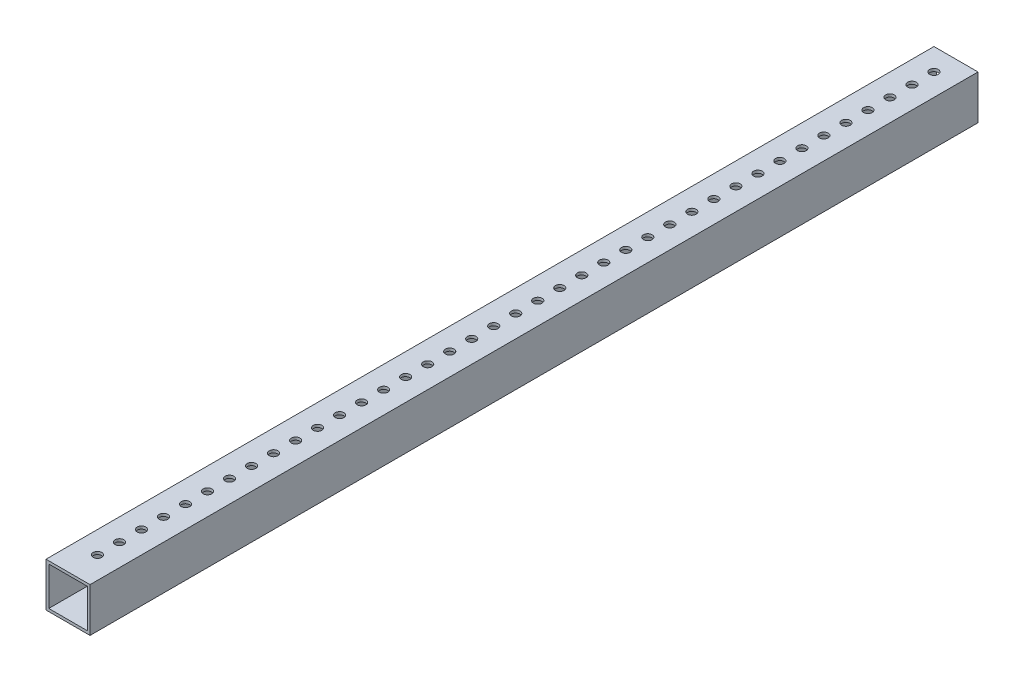
from build123d import *

# Parameters (mm, degrees)
SKETCH1_W               = 25.4
SKETCH1_H               = 25.4
BOSS_EXTRUDE1_DEPTH     = 256.1463
SHELL1_T                = -1.5875
CUT_EXTRUDE1_DEPTH      = 257.775207144
CUT_EXTRUDE1_DEPTH_BACK = 257.775207144
SKETCH3_R               = 2.4892


with BuildPart() as part:
    # Sketch1 → Boss-Extrude1 (new, symmetric)
    with BuildSketch(Plane.XY):
        Rectangle(SKETCH1_W, SKETCH1_H)
    extrude(amount=BOSS_EXTRUDE1_DEPTH, both=True)

    # Shell1
    shell1_openings = [part.faces().sort_by_distance(p)[0] for p in [
        (0, 0, -256.1463),
        (0, 0, 256.1463),
    ]]
    offset(amount=SHELL1_T, openings=shell1_openings, kind=Kind.INTERSECTION)

    # Sketch3 → Cut-Extrude1 (cut, two sides: drawn at the far end of the back side and taken through both)
    with BuildSketch(Plane(origin=(0, 0, 0), x_dir=(1, 0, 0), z_dir=(0, 1, 0)).offset(-CUT_EXTRUDE1_DEPTH_BACK)):
        with Locations((0, 243.4463)):
            Circle(SKETCH3_R)
        with Locations((0, 230.7463)):
            Circle(SKETCH3_R)
        with Locations((0, 218.0463)):
            Circle(SKETCH3_R)
        with Locations((0, 205.3463)):
            Circle(SKETCH3_R)
        with Locations((0, 192.6463)):
            Circle(SKETCH3_R)
        with Locations((0, 179.9463)):
            Circle(SKETCH3_R)
        with Locations((0, 167.2463)):
            Circle(SKETCH3_R)
        with Locations((0, 154.5463)):
            Circle(SKETCH3_R)
        with Locations((0, 141.8463)):
            Circle(SKETCH3_R)
        with Locations((0, 129.1463)):
            Circle(SKETCH3_R)
        with Locations((0, 116.4463)):
            Circle(SKETCH3_R)
        with Locations((0, 103.7463)):
            Circle(SKETCH3_R)
        with Locations((0, 91.0463)):
            Circle(SKETCH3_R)
        with Locations((0, 78.3463)):
            Circle(SKETCH3_R)
        with Locations((0, 65.6463)):
            Circle(SKETCH3_R)
        with Locations((0, 52.9463)):
            Circle(SKETCH3_R)
        with Locations((0, 40.2463)):
            Circle(SKETCH3_R)
        with Locations((0, 27.5463)):
            Circle(SKETCH3_R)
        with Locations((0, 14.8463)):
            Circle(SKETCH3_R)
        with Locations((0, 2.1463)):
            Circle(SKETCH3_R)
        with Locations((0, -10.5537)):
            Circle(SKETCH3_R)
        with Locations((0, -23.2537)):
            Circle(SKETCH3_R)
        with Locations((0, -35.9537)):
            Circle(SKETCH3_R)
        with Locations((0, -48.6537)):
            Circle(SKETCH3_R)
        with Locations((0, -61.3537)):
            Circle(SKETCH3_R)
        with Locations((0, -74.0537)):
            Circle(SKETCH3_R)
        with Locations((0, -86.7537)):
            Circle(SKETCH3_R)
        with Locations((0, -99.4537)):
            Circle(SKETCH3_R)
        with Locations((0, -112.1537)):
            Circle(SKETCH3_R)
        with Locations((0, -124.8537)):
            Circle(SKETCH3_R)
        with Locations((0, -137.5537)):
            Circle(SKETCH3_R)
        with Locations((0, -150.2537)):
            Circle(SKETCH3_R)
        with Locations((0, -162.9537)):
            Circle(SKETCH3_R)
        with Locations((0, -175.6537)):
            Circle(SKETCH3_R)
        with Locations((0, -188.3537)):
            Circle(SKETCH3_R)
        with Locations((0, -201.0537)):
            Circle(SKETCH3_R)
        with Locations((0, -213.7537)):
            Circle(SKETCH3_R)
        with Locations((0, -226.4537)):
            Circle(SKETCH3_R)
        with Locations((0, -239.1537)):
            Circle(SKETCH3_R)
    extrude(amount=CUT_EXTRUDE1_DEPTH + CUT_EXTRUDE1_DEPTH_BACK, mode=Mode.SUBTRACT)


solid = part.part
